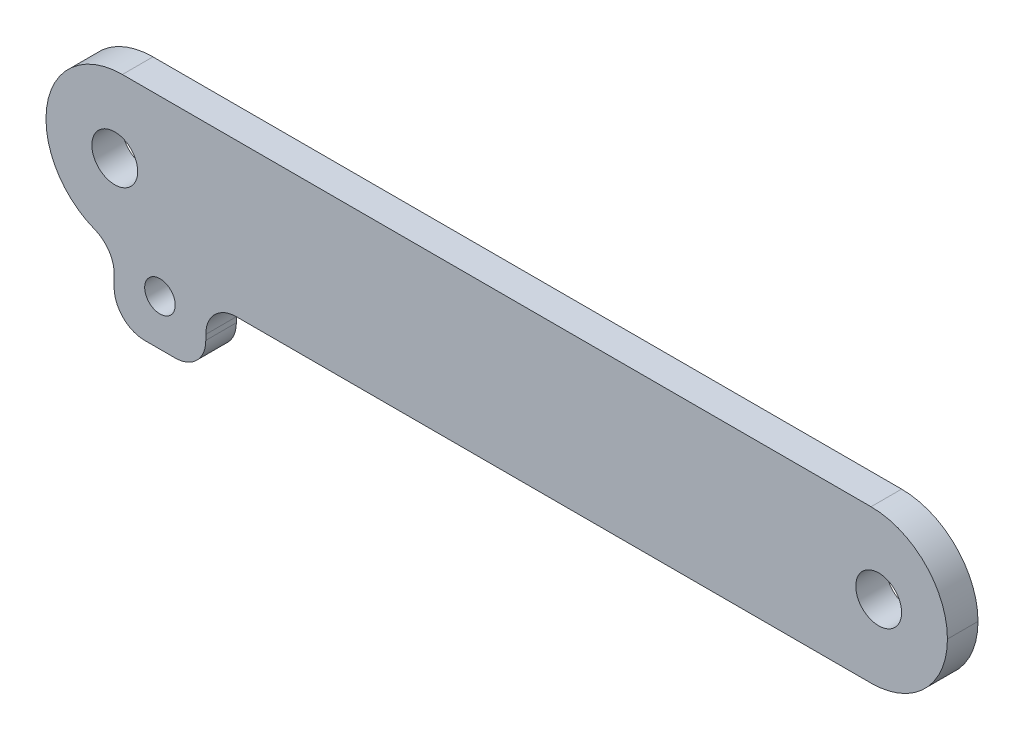
from build123d import *

# Parameters (mm, degrees)
SKETCH1_R           = 1.5
SKETCH1_R_2         = 1
BOSS_EXTRUDE1_DEPTH = 2
FILLET2_R           = 5
FILLET3_R           = 2


with BuildPart() as part:
    # Sketch1 → Boss-Extrude1 (new body)
    with BuildSketch(Plane.XY):
        Polygon((0, 0), (0, 10), (59, 10), (59, 0), (10.458327832, 0), (10.458327832, -4.344154509), (4.458327832, -4.344154509), (4.458327832, 0), align=None)
        with Locations((4.5, 5)):
            Circle(SKETCH1_R, mode=Mode.SUBTRACT)
        with Locations((54.5, 5)):
            Circle(SKETCH1_R, mode=Mode.SUBTRACT)
        with Locations((7.458327832, -1.344154509)):
            Circle(SKETCH1_R_2, mode=Mode.SUBTRACT)
    extrude(amount=BOSS_EXTRUDE1_DEPTH)

    # Fillet2
    # the kernel refuses this fillet: 5 mm, written as the material it takes off along each edge
    with BuildSketch(Plane(origin=(59, 0, -12.5), x_dir=(0, 1, 0), z_dir=(0, 0, 1)), Plane(origin=(59, 10, -12.5), x_dir=(-1, 0, 0), z_dir=(0, 0, 1)), Plane(origin=(0, 10, -12.5), x_dir=(0, -1, 0), z_dir=(0, 0, 1))) as fillet2_piece_1:
        with BuildLine():
            CenterArc((FILLET2_R, FILLET2_R), FILLET2_R, 180, 90)
            Line((0, FILLET2_R), (-FILLET2_R * 0.02, FILLET2_R))
            Line((-FILLET2_R * 0.02, FILLET2_R), (-FILLET2_R * 0.02, -FILLET2_R * 0.02))
            Line((-FILLET2_R * 0.02, -FILLET2_R * 0.02), (FILLET2_R, -FILLET2_R * 0.02))
            Line((FILLET2_R, -FILLET2_R * 0.02), (FILLET2_R, 0))
        make_face()
    extrude(amount=27, mode=Mode.SUBTRACT)
    with BuildSketch(Plane(origin=(0, 0, -12.426431322), x_dir=(0, 1, 0), z_dir=(0, 0, 1))) as fillet2_piece_2:
        with BuildLine():
            CenterArc((4.970572529, -5), FILLET2_R, 90, 83.780688145)
            Line((0, -4.458327832), (-0.099411451, -4.447494389))
            ThreePointArc((-0.099411451, -4.447494389), (-0.1, -2.229163916), (-0.1, 0))
            Line((-0.1, 0), (0, 0.1))
            Line((0, 0.1), (4.970572529, 0.1))
            Line((4.970572529, 0.1), (4.970572529, 0))
        make_face()
    extrude(amount=26.852862643, mode=Mode.SUBTRACT)

    # Fillet3
    fillet3_edges = [part.edges().sort_by_distance(p)[0] for p in [
        (10.458327832, 0, 1),
        (10.458327832, -4.344154509, 1),
        (4.458327832, -4.344154509, 1),
        (4.458327832, 0, 1),
    ]]
    fillet(fillet3_edges, radius=FILLET3_R)


solid = part.part
